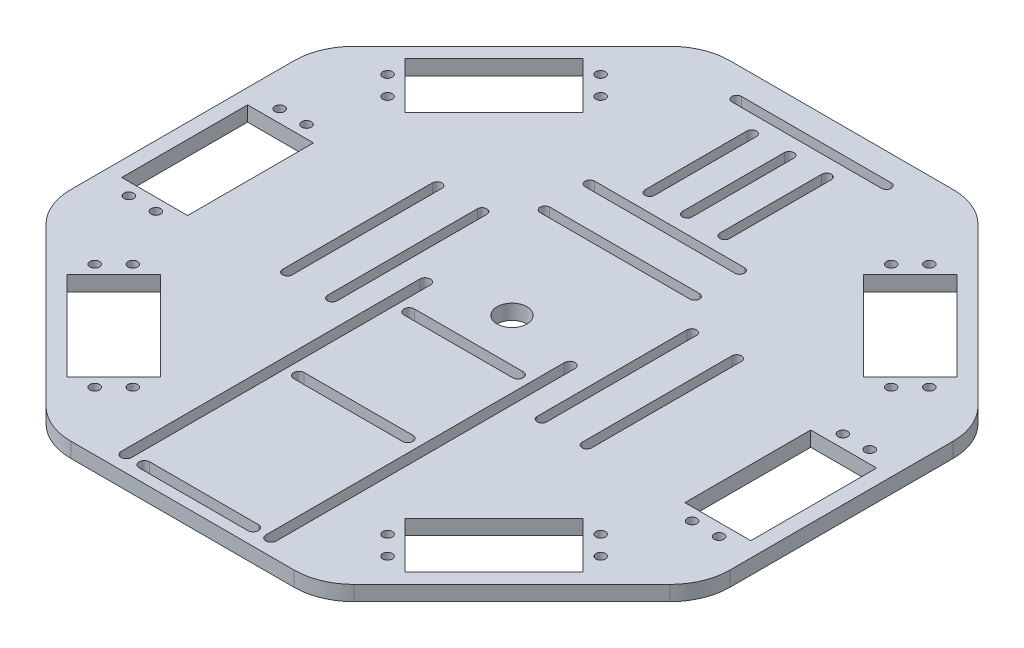
from build123d import *

# Parameters (mm, degrees)
BASEPLATE_DEPTH          = 5
FILLET1_R                = 20
SKETCH2_W                = 22
SKETCH2_H                = 42
SKETCH2_R                = 1.6
SERVO_HOLE_DEPTH         = 156.643824163
SKETCH3_R                = 5
CENTER_HOLE_DEPTH        = 156.643824163
SERVO_HOLE_PATTERN_COUNT = 8
MIRROR1_COPY_1_SKETCH_W  = 22
MIRROR1_COPY_1_SKETCH_H  = 42
MIRROR1_COPY_1_SKETCH_R  = 1.6
MIRROR1_COPY_1_DEPTH     = 156.643824163
MIRROR1_COPY_2_SKETCH_W  = 22
MIRROR1_COPY_2_SKETCH_H  = 42
MIRROR1_COPY_2_SKETCH_R  = 1.6
MIRROR1_COPY_2_DEPTH     = 156.643824163
SLITS_DEPTH              = 156.643824163
CUT_EXTRUDE1_DEPTH       = 156.643824163


with BuildPart() as part:
    # Sketch1 → Baseplate (new body)
    with BuildSketch(Plane(origin=(0, 0, 0), x_dir=(1, 0, 0), z_dir=(0, 1, 0))):
        Polygon((-110, 45.563491861), (-110, -45.563491861), (-45.563491861, -110), (45.563491861, -110), (110, -45.563491861), (110, 45.563491861), (45.563491861, 110), (-45.563491861, 110), align=None)
    extrude(amount=BASEPLATE_DEPTH)

    # Fillet1
    fillet1_edges = [part.edges().sort_by_distance(p)[0] for p in [
        (-110, 2.5, -45.563491861),
        (-45.563491861, 2.5, -110),
        (45.563491861, 2.5, -110),
        (110, 2.5, -45.563491861),
        (110, 2.5, 45.563491861),
        (45.563491861, 2.5, 110),
        (-45.563491861, 2.5, 110),
        (-110, 2.5, 45.563491861),
    ]]
    fillet(fillet1_edges, radius=FILLET1_R)

    # Sketch2 → Servo hole (cut, through all)
    with BuildSketch(Plane(origin=(0, 5, 0), x_dir=(1, 0, 0), z_dir=(0, 1, 0))):
        with Locations((94, -4.279220614)):
            Rectangle(SKETCH2_W, SKETCH2_H)
        with Locations((98.5, 20.920779386)):
            Circle(SKETCH2_R)
        with Locations((89.5, 20.920779386)):
            Circle(SKETCH2_R)
        with Locations((89.5, -29.379220614)):
            Circle(SKETCH2_R)
        with Locations((98.5, -29.379220614)):
            Circle(SKETCH2_R)
    servo_hole = extrude(amount=-SERVO_HOLE_DEPTH, mode=Mode.SUBTRACT)

    # Sketch3 → Center hole (cut, through all)
    with BuildSketch(Plane(origin=(0, 5, 0), x_dir=(1, 0, 0), z_dir=(0, 1, 0))):
        Circle(SKETCH3_R)
    extrude(amount=-CENTER_HOLE_DEPTH, mode=Mode.SUBTRACT)

    # Servo hole pattern: Servo hole ×8 about axis, 5 skipped
    servo_hole_pattern_axis = Axis((0, 5, 0), (0, 1, 0))
    add([servo_hole.rotate(servo_hole_pattern_axis, i * 360 / SERVO_HOLE_PATTERN_COUNT) for i in range(1, SERVO_HOLE_PATTERN_COUNT) if i not in (2, 3, 4, 5, 6)], mode=Mode.SUBTRACT)

    # Mirror1: Servo hole across plane
    add(servo_hole.mirror(Plane(origin=(0, 0, 0), x_dir=(0, 0, 1), z_dir=(1, 0, 0))), mode=Mode.SUBTRACT)

    # Mirror1 copy 1 sketch → Mirror1 copy 1 (cut, through all)
    with BuildSketch(Plane(origin=(0, 5, 0), x_dir=(-0.7071067811865476, 0, -0.7071067811865475), z_dir=(0, 1, 0))):
        with Locations((94, 4.279220614)):
            Rectangle(MIRROR1_COPY_1_SKETCH_W, MIRROR1_COPY_1_SKETCH_H)
        with Locations((98.5, -20.920779386)):
            Circle(MIRROR1_COPY_1_SKETCH_R)
        with Locations((89.5, -20.920779386)):
            Circle(MIRROR1_COPY_1_SKETCH_R)
        with Locations((89.5, 29.379220614)):
            Circle(MIRROR1_COPY_1_SKETCH_R)
        with Locations((98.5, 29.379220614)):
            Circle(MIRROR1_COPY_1_SKETCH_R)
    extrude(amount=-MIRROR1_COPY_1_DEPTH, mode=Mode.SUBTRACT)

    # Mirror1 copy 2 sketch → Mirror1 copy 2 (cut, through all)
    with BuildSketch(Plane(origin=(0, 5, 0), x_dir=(-0.7071067811865474, 0, 0.7071067811865477), z_dir=(0, 1, 0))):
        with Locations((94, 4.279220614)):
            Rectangle(MIRROR1_COPY_2_SKETCH_W, MIRROR1_COPY_2_SKETCH_H)
        with Locations((98.5, -20.920779386)):
            Circle(MIRROR1_COPY_2_SKETCH_R)
        with Locations((89.5, -20.920779386)):
            Circle(MIRROR1_COPY_2_SKETCH_R)
        with Locations((89.5, 29.379220614)):
            Circle(MIRROR1_COPY_2_SKETCH_R)
        with Locations((98.5, 29.379220614)):
            Circle(MIRROR1_COPY_2_SKETCH_R)
    extrude(amount=-MIRROR1_COPY_2_DEPTH, mode=Mode.SUBTRACT)

    # Sketch5 → Slits (cut, through all)
    with BuildSketch(Plane(origin=(0, 5, 0), x_dir=(1, 0, 0), z_dir=(0, 1, 0))):
        with BuildLine():
            Line((25, 37.6), (-25, 37.6))
            ThreePointArc((-25, 37.6), (-26.6, 36), (-25, 34.4))
            Line((-25, 34.4), (25, 34.4))
            ThreePointArc((25, 34.4), (26.6, 36), (25, 37.6))
        make_face()
        with BuildLine():
            Line((25, 52.6), (-25, 52.6))
            ThreePointArc((-25, 52.6), (-26.6, 51), (-25, 49.4))
            Line((-25, 49.4), (25, 49.4))
            ThreePointArc((25, 49.4), (26.6, 51), (25, 52.6))
        make_face()
        with BuildLine():
            Line((-48.4, -25), (-48.4, 25))
            ThreePointArc((-48.4, 25), (-50, 26.6), (-51.6, 25))
            Line((-51.6, 25), (-51.6, -25))
            ThreePointArc((-51.6, -25), (-50, -26.6), (-48.4, -25))
        make_face()
        with BuildLine():
            Line((-33.4, -25), (-33.4, 25))
            ThreePointArc((-33.4, 25), (-35, 26.6), (-36.6, 25))
            Line((-36.6, 25), (-36.6, -25))
            ThreePointArc((-36.6, -25), (-35, -26.6), (-33.4, -25))
        make_face()
        with BuildLine():
            Line((36.6, -25), (36.6, 25))
            ThreePointArc((36.6, 25), (35, 26.6), (33.4, 25))
            Line((33.4, 25), (33.4, -25))
            ThreePointArc((33.4, -25), (35, -26.6), (36.6, -25))
        make_face()
        with BuildLine():
            Line((51.6, -25), (51.6, 25))
            ThreePointArc((51.6, 25), (50, 26.6), (48.4, 25))
            Line((48.4, 25), (48.4, -25))
            ThreePointArc((48.4, -25), (50, -26.6), (51.6, -25))
        make_face()
        with BuildLine():
            Line((25, 101.6), (-25, 101.6))
            ThreePointArc((-25, 101.6), (-26.6, 100), (-25, 98.4))
            Line((-25, 98.4), (25, 98.4))
            ThreePointArc((25, 98.4), (26.6, 100), (25, 101.6))
        make_face()
        with BuildLine():
            Line((-10.9, 58.5), (-10.9, 92.5))
            ThreePointArc((-10.9, 92.5), (-12.5, 94.1), (-14.1, 92.5))
            Line((-14.1, 92.5), (-14.1, 58.5))
            ThreePointArc((-14.1, 58.5), (-12.5, 56.9), (-10.9, 58.5))
        make_face()
        with BuildLine():
            Line((14.1, 58.5), (14.1, 92.5))
            ThreePointArc((14.1, 92.5), (12.5, 94.1), (10.9, 92.5))
            Line((10.9, 92.5), (10.9, 58.5))
            ThreePointArc((10.9, 58.5), (12.5, 56.9), (14.1, 58.5))
        make_face()
        with BuildLine():
            Line((1.6, 58.5), (1.6, 92.5))
            ThreePointArc((1.6, 92.5), (0, 94.1), (-1.6, 92.5))
            Line((-1.6, 92.5), (-1.6, 58.5))
            ThreePointArc((-1.6, 58.5), (0, 56.9), (1.6, 58.5))
        make_face()
    extrude(amount=-SLITS_DEPTH, mode=Mode.SUBTRACT)

    # Sketch6 → Cut-Extrude1 (cut, through all)
    with BuildSketch(Plane(origin=(0, 5, 0), x_dir=(1, 0, 0), z_dir=(0, 1, 0))):
        with BuildLine():
            Line((25.9, -104.570458304), (25.9, -4.855098268))
            ThreePointArc((25.9, -4.855098268), (24.15, -3.105098268), (22.4, -4.855098268))
            Line((22.4, -4.855098268), (22.4, -104.570458304))
            ThreePointArc((22.4, -104.570458304), (24.15, -106.320458304), (25.9, -104.570458304))
        make_face()
        with BuildLine():
            Line((-25.9, -4.855098268), (-25.9, -104.570458304))
            ThreePointArc((-25.9, -104.570458304), (-24.15, -106.320458304), (-22.4, -104.570458304))
            Line((-22.4, -104.570458304), (-22.4, -4.855098268))
            ThreePointArc((-22.4, -4.855098268), (-24.15, -3.105098268), (-25.9, -4.855098268))
        make_face()
        with BuildLine():
            Line((18.15, -51.220458304), (-18.15, -51.220458304))
            ThreePointArc((-18.15, -51.220458304), (-19.9, -52.970458304), (-18.15, -54.720458304))
            Line((-18.15, -54.720458304), (18.15, -54.720458304))
            ThreePointArc((18.15, -54.720458304), (19.9, -52.970458304), (18.15, -51.220458304))
        make_face()
        with BuildLine():
            Line((18.15, -102.820458304), (-18.15, -102.820458304))
            ThreePointArc((-18.15, -102.820458304), (-19.9, -104.570458304), (-18.15, -106.320458304))
            Line((-18.15, -106.320458304), (18.15, -106.320458304))
            ThreePointArc((18.15, -106.320458304), (19.9, -104.570458304), (18.15, -102.820458304))
        make_face()
        with BuildLine():
            Line((18.15, -14.423806901), (-18.15, -14.423806901))
            ThreePointArc((-18.15, -14.423806901), (-19.9, -16.173806901), (-18.15, -17.923806901))
            Line((-18.15, -17.923806901), (18.15, -17.923806901))
            ThreePointArc((18.15, -17.923806901), (19.9, -16.173806901), (18.15, -14.423806901))
        make_face()
    extrude(amount=-CUT_EXTRUDE1_DEPTH, mode=Mode.SUBTRACT)


solid = part.part
